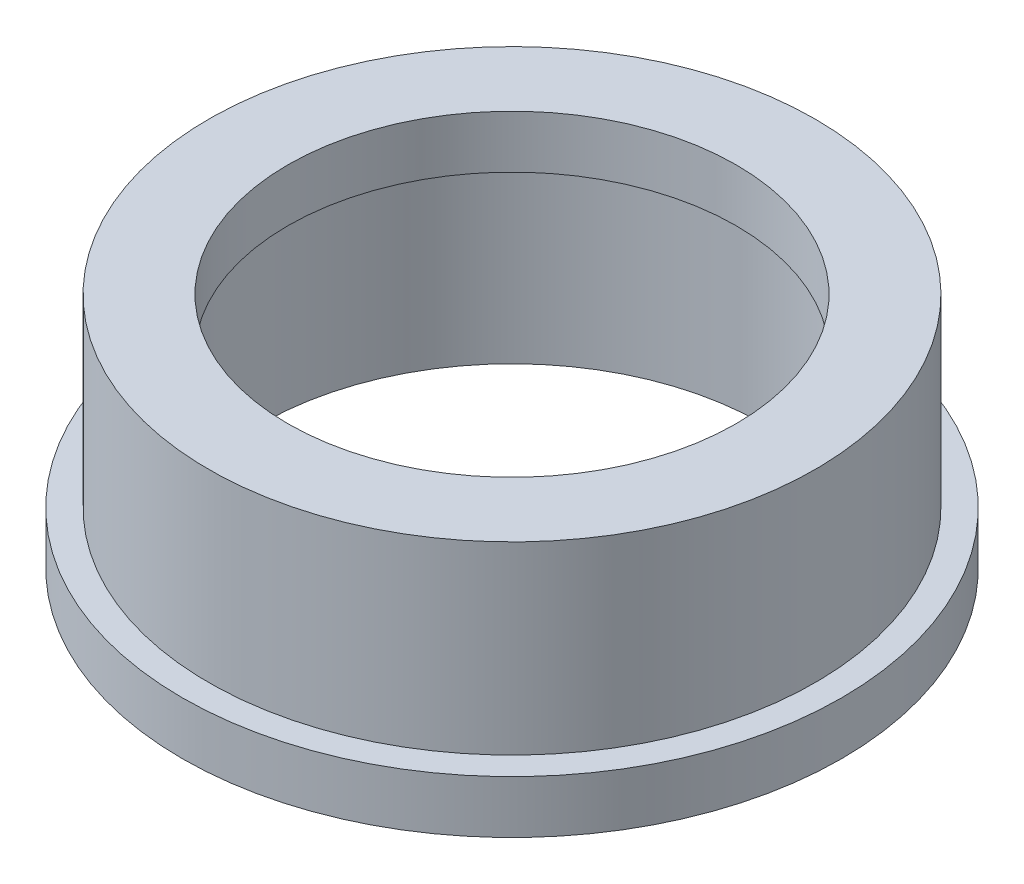
from build123d import *


with BuildPart() as part:
    # Эскиз1 → Повернуть1 (revolve)
    with BuildSketch(Plane.XY):
        Polygon((9.5, 7), (9.5, 0), (12.5, 0), (12.5, 2), (11.5, 2), (11.5, 9), (8.5, 9), (8.5, 7), align=None)
    revolve(axis=Axis((0, 0, 0), (0, 1, 0)))


solid = part.part
